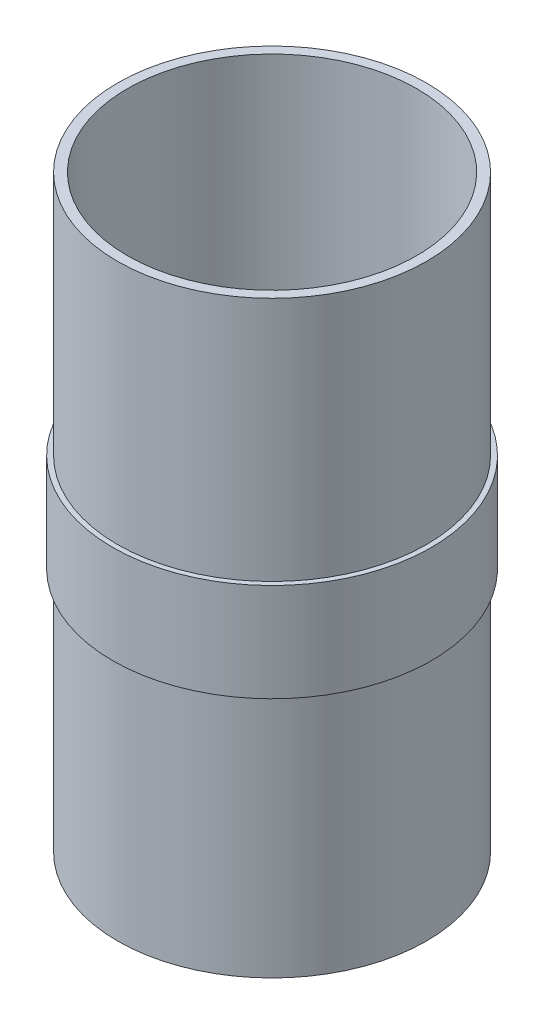
from build123d import *

# Parameters (mm, degrees)
ESBO_O1_R                = 31.5
ESBO_O1_R_2              = 29.5
RESSALTO_EXTRUS_O1_DEPTH = 50
ESBO_O2_R                = 32.5
ESBO_O2_R_2              = 29.5
RESSALTO_EXTRUS_O2_DEPTH = 20
ESBO_O3_R                = 31.5
ESBO_O3_R_2              = 29.5
RESSALTO_EXTRUS_O3_DEPTH = 50
ESBO_O6_R                = 30.5
RESSALTO_EXTRUS_O4_DEPTH = 5


with BuildPart() as part:
    # Esboço1 → Ressalto-extrusão1 (new body)
    with BuildSketch(Plane(origin=(0, 0, 0), x_dir=(1, 0, 0), z_dir=(0, 1, 0))):
        Circle(ESBO_O1_R)
        Circle(ESBO_O1_R_2, mode=Mode.SUBTRACT)
    extrude(amount=RESSALTO_EXTRUS_O1_DEPTH)


with BuildPart() as body_2:
    # Esboço2 → Ressalto-extrusão2 (new body)
    with BuildSketch(Plane(origin=(0, 50, 0), x_dir=(1, 0, 0), z_dir=(0, 1, 0))):
        Circle(ESBO_O2_R)
        Circle(ESBO_O2_R_2, mode=Mode.SUBTRACT)
    extrude(amount=RESSALTO_EXTRUS_O2_DEPTH)



with BuildPart() as body_3:
    # Esboço3 → Ressalto-extrusão3 (new body)
    with BuildSketch(Plane(origin=(0, 70, 0), x_dir=(1, 0, 0), z_dir=(0, 1, 0))):
        Circle(ESBO_O3_R)
        Circle(ESBO_O3_R_2, mode=Mode.SUBTRACT)
    extrude(amount=RESSALTO_EXTRUS_O3_DEPTH)


with BuildPart() as body_2_1:
    add(body_2.part)

    add(body_3.part)  # Ressalto-extrusão4 merges body 3
    # Esboço6 → Ressalto-extrusão4 (add)
    with BuildSketch(Plane(origin=(0, 70, 0), x_dir=(1, 0, 0), z_dir=(0, 1, 0))):
        Circle(ESBO_O6_R)
    extrude(amount=-RESSALTO_EXTRUS_O4_DEPTH)


with BuildPart() as part_1:
    add(part.part)

    # Combinar3: union body 2
    add(body_2_1.part)


solid = part_1.part
